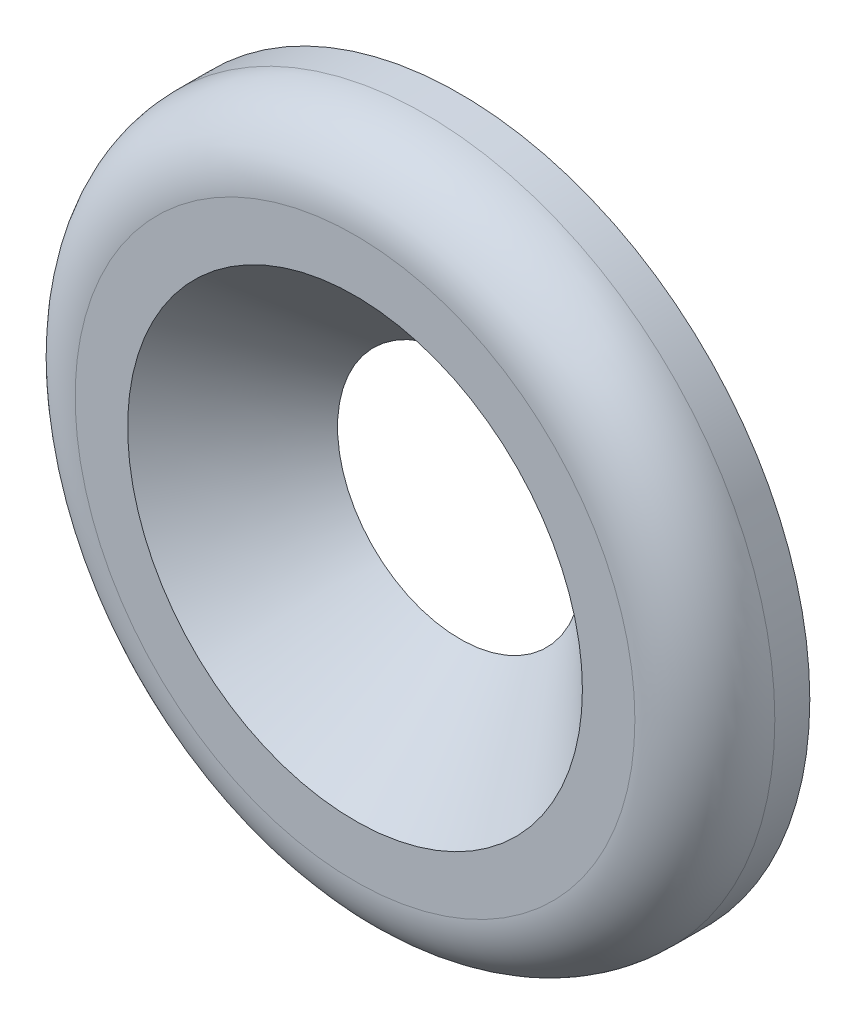
from build123d import *

# Parameters (mm, degrees)
SKETCH1_R           = 5
BOSS_EXTRUDE1_DEPTH = 1.5
SKETCH2_R           = 1.75
CUT_EXTRUDE1_DEPTH  = 8.228416147
CHAMFER1_SIZE       = 1.5
FILLET1_R           = 1


with BuildPart() as part:
    # Sketch1 → Boss-Extrude1 (new body)
    with BuildSketch(Plane.XY):
        Circle(SKETCH1_R)
    extrude(amount=BOSS_EXTRUDE1_DEPTH)

    # Sketch2 → Cut-Extrude1 (cut, through all)
    with BuildSketch(Plane.XY):
        Circle(SKETCH2_R)
    extrude(amount=CUT_EXTRUDE1_DEPTH, mode=Mode.SUBTRACT)

    # Chamfer1
    chamfer1_edges = [part.edges().sort_by_distance(p)[0] for p in [
        (-1.75, 0, 1.5),
    ]]
    chamfer(chamfer1_edges, length=CHAMFER1_SIZE - 0.0001)  # a hair under: the kernel refuses the full size

    # Fillet1
    fillet1_edges = [part.edges().sort_by_distance(p)[0] for p in [
        (-5, 0, 1.5),
    ]]
    fillet(fillet1_edges, radius=FILLET1_R)


solid = part.part
